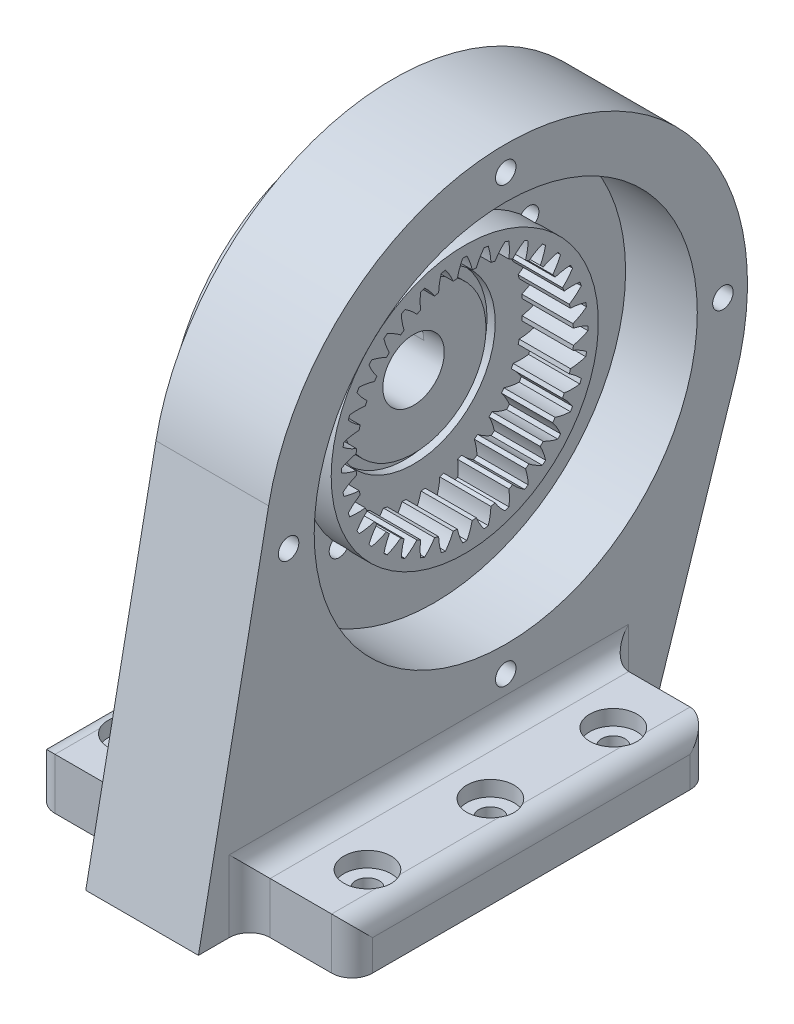
from build123d import *

# Parameters (mm, degrees)
BASPROSKE_W                                         = 12.7
BASPROSKE_H                                         = 3.598545
TOOTHCUT_DEPTH                                      = 46.081063624
TEETHCUTS_COUNT                                     = 36
EXTRUDE_THIN1_START                                 = 12.7
SKETCH3_R                                           = 33.126045
SKETCH3_R_2                                         = 30.586045
EXTRUDE_THIN1_DEPTH                                 = 12.7
EXTRUDE_THIN2_START                                 = 5.08
SKETCH4_R                                           = 39.476045
SKETCH4_R_2                                         = 33.126045
EXTRUDE_THIN2_DEPTH                                 = 5.08
BOSS_EXTRUDE2_START                                 = -5.08
SKETCH9_R                                           = 59.944
SKETCH9_R_2                                         = 39.476045
BOSS_EXTRUDE2_DEPTH                                 = 5.08
SKETCH12_R                                          = 59.944
BOSS_EXTRUDE3_DEPTH                                 = 5.08
SKETCH13_R                                          = 20.2565
SKETCH13_R_2                                        = 17.9705
CUT_EXTRUDE10_DEPTH                                 = 2.032
CUT_EXTRUDE11_DEPTH                                 = 87.618096677
CUT_EXTRUDE11_DEPTH_BACK                            = 87.618096677
SKETCH14_R                                          = 3.302
BOSS_EXTRUDE5_START                                 = 17.78
SKETCH15_R                                          = 59.944
SKETCH15_R_2                                        = 47.498
BOSS_EXTRUDE5_DEPTH                                 = 17.78
CBORE_FOR_00_BINDING_HEAD_MACHINE_SCREW_D           = 5.08
CBORE_FOR_00_BINDING_HEAD_MACHINE_SCREW_CBORE_D     = 7.62
CBORE_FOR_00_BINDING_HEAD_MACHINE_SCREW_CBORE_DEPTH = 1.27
SKETCH21_R                                          = 19.05
CUT_EXTRUDE12_DEPTH                                 = 1.524
SKETCH22_R                                          = 2.5
CUT_EXTRUDE13_DEPTH                                 = 90.259228498
SKETCH23_R                                          = 2.794
CUT_EXTRUDE14_DEPTH                                 = 7.62
BOSS_EXTRUDE6_DEPTH                                 = 3.81
SKETCH26_R                                          = 7.62
CUT_EXTRUDE15_DEPTH                                 = 89.793982499
BOSS_EXTRUDE8_START                                 = 1.524
SKETCH28_R                                          = 19.05
SKETCH28_R_2                                        = 7.62
BOSS_EXTRUDE8_DEPTH                                 = 1.524
SKETCH29_R                                          = 44.45
BOSS_EXTRUDE9_DEPTH                                 = 11.62
SKETCH30_R                                          = 7.62
SKETCH30_R_2                                        = 2.5
CUT_EXTRUDE16_DEPTH                                 = 90.259228498
SKETCH31_W                                          = 15.24
SKETCH31_H                                          = 50.8
CUT_EXTRUDE17_DEPTH                                 = 11.62
SKETCH32_R                                          = 19.05
CUT_EXTRUDE18_DEPTH                                 = 1.6
SKETCH33_R                                          = 3.048
CUT_EXTRUDE19_DEPTH                                 = 3.81
CIRPATTERN1_COUNT                                   = 4
BOSS_EXTRUDE10_DEPTH                                = 27.94
BOSS_EXTRUDE12_DEPTH                                = 25.4
BOSS_EXTRUDE12_DEPTH_BACK                           = 53.34
SKETCH45_W                                          = 88.9
SKETCH45_H                                          = 12.7
FILLET2_R                                           = 5.08
FILLET3_R                                           = 5.08
CBORE_FOR_M5_HEX_HEAD_MACHINE_SCREW1_D              = 5.8
CBORE_FOR_M5_HEX_HEAD_MACHINE_SCREW1_DEPTH          = 12.7
CBORE_FOR_M5_HEX_HEAD_MACHINE_SCREW1_CBORE_D        = 11.71
CBORE_FOR_M5_HEX_HEAD_MACHINE_SCREW1_CBORE_DEPTH    = 3.8


with BuildPart() as part:
    # BasProSke → Base-Revolve (revolve)
    with BuildSketch(Plane(origin=(0, 0, 0), x_dir=(1, 0, 0), z_dir=(0, 1, 0)), mode=Mode.PRIVATE) as base_revolve_sk:
        with Locations((6.35, 28.7867725)):
            Rectangle(BASPROSKE_W, BASPROSKE_H)
    revolve(base_revolve_sk.sketch.rotate(Axis((-10, 0, 0), (1, 0, 0)), 180), axis=Axis((-10, 0, 0), (1, 0, 0)))

    # TooCutSke → ToothCut (cut, through all)
    with BuildSketch(Plane(origin=(0, 0, 0), x_dir=(0, 0, -1), z_dir=(1, 0, 0))):
        with BuildLine():
            ThreePointArc((1.841725032, 26.899124248), (1.308199168, 28.772624617), (0.524789557, 30.556138806))
            ThreePointArc((0.524789557, 30.556138806), (0, 30.560645), (-0.524789557, 30.556138806))
            ThreePointArc((-0.524789557, 30.556138806), (-1.308199168, 28.772624617), (-1.841725032, 26.899124248))
            ThreePointArc((-1.841725032, 26.899124248), (0, 26.9621), (1.841725032, 26.899124248))
        make_face()
    toothcut = extrude(amount=TOOTHCUT_DEPTH, mode=Mode.SUBTRACT)

    # TeethCuts: ToothCut ×36 about axis
    teethcuts_axis = Axis((0, 0, 0), (1, 0, 0))
    for i in range(1, TEETHCUTS_COUNT):
        add(toothcut.rotate(teethcuts_axis, i * 360 / TEETHCUTS_COUNT), mode=Mode.SUBTRACT)

    # Sketch3 → Extrude-Thin1 (add)
    with BuildSketch(Plane(origin=(0, 0, 0), x_dir=(0, 0, -1), z_dir=(1, 0, 0)).offset(EXTRUDE_THIN1_START)):
        Circle(SKETCH3_R)
        Circle(SKETCH3_R_2, mode=Mode.SUBTRACT)
    extrude(amount=-EXTRUDE_THIN1_DEPTH)

    # Sketch4 → Extrude-Thin2 (add)
    with BuildSketch(Plane(origin=(0, 0, 0), x_dir=(0, 0, -1), z_dir=(1, 0, 0)).offset(EXTRUDE_THIN2_START)):
        Circle(SKETCH4_R)
        Circle(SKETCH4_R_2, mode=Mode.SUBTRACT)
    extrude(amount=-EXTRUDE_THIN2_DEPTH)

    # Sketch9 → Boss-Extrude2 (add)
    with BuildSketch(Plane.ZY.offset(BOSS_EXTRUDE2_START)):
        Circle(SKETCH9_R)
        Circle(SKETCH9_R_2, mode=Mode.SUBTRACT)
    extrude(amount=BOSS_EXTRUDE2_DEPTH)

    # Sketch12 → Boss-Extrude3 (add)
    with BuildSketch(Plane.ZY):
        Circle(SKETCH12_R)
    extrude(amount=BOSS_EXTRUDE3_DEPTH)

    # Sketch13 → Cut-Extrude10 (cut)
    with BuildSketch(Plane(origin=(0, 0, 0), x_dir=(0, 0, -1), z_dir=(1, 0, 0))):
        Circle(SKETCH13_R)
        Circle(SKETCH13_R_2, mode=Mode.SUBTRACT)
    extrude(amount=-CUT_EXTRUDE10_DEPTH, mode=Mode.SUBTRACT)

    # Sketch14 → Cut-Extrude11 (cut, two sides: drawn at the far end of the back side and taken through both)
    with BuildSketch(Plane.ZY.offset(5.08).offset(-CUT_EXTRUDE11_DEPTH_BACK)):
        Circle(SKETCH14_R)
    extrude(amount=CUT_EXTRUDE11_DEPTH + CUT_EXTRUDE11_DEPTH_BACK, mode=Mode.SUBTRACT)

    # Sketch15 → Boss-Extrude5 (add)
    with BuildSketch(Plane(origin=(5.08, 0, 0), x_dir=(0, 0, -1), z_dir=(1, 0, 0)).offset(BOSS_EXTRUDE5_START)):
        with Locations(Location((0, 0, 0), (0, 0, 180))):
            Circle(SKETCH15_R)
        Circle(SKETCH15_R_2, mode=Mode.SUBTRACT)
    extrude(amount=-BOSS_EXTRUDE5_DEPTH)

    # CBORE for #00 Binding Head Machine Screw1 (through all)
    with Locations(Plane.ZY.offset(5.08)):
        with Locations((0, 53.848), (53.848, 0), (0, -53.848), (-53.848, 0)):
            CounterBoreHole(CBORE_FOR_00_BINDING_HEAD_MACHINE_SCREW_D / 2, CBORE_FOR_00_BINDING_HEAD_MACHINE_SCREW_CBORE_D / 2, CBORE_FOR_00_BINDING_HEAD_MACHINE_SCREW_CBORE_DEPTH)

    # Sketch21 → Cut-Extrude12 (cut)
    with BuildSketch(Plane.ZY.offset(5.08)):
        Circle(SKETCH21_R)
    extrude(amount=-CUT_EXTRUDE12_DEPTH, mode=Mode.SUBTRACT)

    # Sketch22 → Cut-Extrude13 (cut, through all)
    with BuildSketch(Plane.ZY.offset(5.08)):
        with Locations((23.5, -23.5)):
            Circle(SKETCH22_R)
        with Locations((-23.5, -23.5)):
            Circle(SKETCH22_R)
        with Locations((-23.5, 23.5)):
            Circle(SKETCH22_R)
        with Locations((23.5, 23.5)):
            Circle(SKETCH22_R)
    extrude(amount=-CUT_EXTRUDE13_DEPTH, mode=Mode.SUBTRACT)

    # Sketch23 → Cut-Extrude14 (cut)
    with BuildSketch(Plane(origin=(12.7, 0, 0), x_dir=(0, 0, -1), z_dir=(1, 0, 0))):
        with Locations((23.5, 23.5)):
            Circle(SKETCH23_R)
        with Locations((-23.5, 23.5)):
            Circle(SKETCH23_R)
        with Locations((-23.5, -23.5)):
            Circle(SKETCH23_R)
        with Locations((23.5, -23.5)):
            Circle(SKETCH23_R)
    extrude(amount=-CUT_EXTRUDE14_DEPTH, mode=Mode.SUBTRACT)

    # Sketch24 → Boss-Extrude6 (add)
    with BuildSketch(Plane(origin=(12.7, 0, 0), x_dir=(0, 0, -1), z_dir=(1, 0, 0))):
        with BuildLine():
            ThreePointArc((25.309953723, 21.37150205), (23.423651053, 23.423651053), (21.37150205, 25.309953723))
            ThreePointArc((21.37150205, 25.309953723), (21.524343653, 21.524343653), (25.309953723, 21.37150205))
        make_face()
        with BuildLine():
            ThreePointArc((25.309953723, -21.37150205), (21.524343653, -21.524343653), (21.37150205, -25.309953723))
            ThreePointArc((21.37150205, -25.309953723), (23.423651053, -23.423651053), (25.309953723, -21.37150205))
        make_face()
        with BuildLine():
            ThreePointArc((-21.37150205, -25.309953723), (-21.524343653, -21.524343653), (-25.309953723, -21.37150205))
            ThreePointArc((-25.309953723, -21.37150205), (-23.423651053, -23.423651053), (-21.37150205, -25.309953723))
        make_face()
        with BuildLine():
            ThreePointArc((-25.309953723, 21.37150205), (-21.524343653, 21.524343653), (-21.37150205, 25.309953723))
            ThreePointArc((-21.37150205, 25.309953723), (-23.423651053, 23.423651053), (-25.309953723, 21.37150205))
        make_face()
    extrude(amount=-BOSS_EXTRUDE6_DEPTH)

    # Sketch26 → Cut-Extrude15 (cut, through all)
    with BuildSketch(Plane.ZY.offset(3.556)):
        Circle(SKETCH26_R)
    extrude(amount=-CUT_EXTRUDE15_DEPTH, mode=Mode.SUBTRACT)

    # Sketch28 → Boss-Extrude8 (add)
    with BuildSketch(Plane.ZY.offset(3.556).offset(BOSS_EXTRUDE8_START)):
        Circle(SKETCH28_R)
        Circle(SKETCH28_R_2, mode=Mode.SUBTRACT)
    extrude(amount=-BOSS_EXTRUDE8_DEPTH)

    # Sketch29 → Boss-Extrude9 (add)
    with BuildSketch(Plane.ZY.offset(5.08)):
        Circle(SKETCH29_R)
    extrude(amount=BOSS_EXTRUDE9_DEPTH)

    # Sketch30 → Cut-Extrude16 (cut, through all)
    with BuildSketch(Plane(origin=(-5.08, 0, 0), x_dir=(0, 0, -1), z_dir=(1, 0, 0))):
        with Locations(Location((0, 0, 0), (0, 0, 180))):
            Circle(SKETCH30_R)
        with Locations((23.5, -23.5)):
            Circle(SKETCH30_R_2)
        with Locations((23.5, 23.5)):
            Circle(SKETCH30_R_2)
        with Locations((-23.5, 23.5)):
            Circle(SKETCH30_R_2)
        with Locations((-23.5, -23.5)):
            Circle(SKETCH30_R_2)
    extrude(amount=-CUT_EXTRUDE16_DEPTH, mode=Mode.SUBTRACT)

    # Sketch31 → Cut-Extrude17 (cut)
    with BuildSketch(Plane.ZY.offset(16.7)):
        with Locations((0, 25.4)):
            Rectangle(SKETCH31_W, SKETCH31_H)
    extrude(amount=-CUT_EXTRUDE17_DEPTH, mode=Mode.SUBTRACT)

    # Sketch32 → Cut-Extrude18 (cut)
    with BuildSketch(Plane.ZY.offset(16.7)):
        Circle(SKETCH32_R)
    extrude(amount=-CUT_EXTRUDE18_DEPTH, mode=Mode.SUBTRACT)

    # Sketch33 → Cut-Extrude19 (cut)
    with BuildSketch(Plane(origin=(5.08, 0, 0), x_dir=(0, 0, -1), z_dir=(1, 0, 0))):
        with Locations((-23.5, 23.5)):
            Circle(SKETCH33_R)
    cut_extrude19 = extrude(amount=CUT_EXTRUDE19_DEPTH, mode=Mode.SUBTRACT)

    # CirPattern1: Cut-Extrude19 ×4 about axis
    cirpattern1_axis = Axis((0, 0, 0), (1, 0, 0))
    for i in range(1, CIRPATTERN1_COUNT):
        add(cut_extrude19.rotate(cirpattern1_axis, i * 360 / CIRPATTERN1_COUNT), mode=Mode.SUBTRACT)

    # Sketch34 → Boss-Extrude10 (add)
    with BuildSketch(Plane(origin=(22.86, 0, 0), x_dir=(0, 0, -1), z_dir=(1, 0, 0))):
        with BuildLine():
            Line((-58.801839412, 11.645892745), (-76.2, -76.2))
            Line((-76.2, -76.2), (38.1, -76.2))
            Line((38.1, -76.2), (56.96053076, -18.675681287))
            ThreePointArc((56.96053076, -18.675681287), (-15.188715131, -57.987809656), (-58.801839412, 11.645892745))
        make_face()
    extrude(amount=-BOSS_EXTRUDE10_DEPTH)

    # Sketch45 → Boss-Extrude12 (add, two sides: drawn at the far end of the back side and taken through both)
    with BuildSketch(Plane(origin=(22.86, 0, 0), x_dir=(0, 0, -1), z_dir=(1, 0, 0)).offset(-BOSS_EXTRUDE12_DEPTH_BACK)):
        with Locations((-19.05, -69.85)):
            Rectangle(SKETCH45_W, SKETCH45_H)
    extrude(amount=BOSS_EXTRUDE12_DEPTH + BOSS_EXTRUDE12_DEPTH_BACK)

    # Fillet2
    fillet2_edges = [part.edges().sort_by_distance(p)[0] for p in [
        (22.86, -63.5, 19.05),
        (-5.08, -63.5, 19.05),
        (-5.08, -69.85, -25.4),
        (-5.08, -69.85, 63.5),
        (22.86, -69.85, -25.4),
        (22.86, -69.85, 63.5),
    ]]
    fillet(fillet2_edges, radius=FILLET2_R)

    # Fillet3
    fillet3_edges = [part.edges().sort_by_distance(p)[0] for p in [
        (-30.48, -63.5, 19.05),
        (-30.48, -69.85, -25.4),
        (-30.48, -69.85, 63.5),
        (48.26, -69.85, 63.5),
        (48.26, -69.85, -25.4),
        (48.26, -63.5, 19.05),
    ]]
    fillet(fillet3_edges, radius=FILLET3_R)

    # CBORE for M5 Hex Head Machine Screw1
    with Locations(Plane(origin=(0, -63.5, 0), x_dir=(1, 0, 0), z_dir=(0, 1, 0))):
        with Locations((38.1, -19.05), (-20.32, -19.05), (-20.32, 11.43), (-20.32, -49.53), (38.1, 11.43), (38.1, -49.53)):
            CounterBoreHole(CBORE_FOR_M5_HEX_HEAD_MACHINE_SCREW1_D / 2, CBORE_FOR_M5_HEX_HEAD_MACHINE_SCREW1_CBORE_D / 2, CBORE_FOR_M5_HEX_HEAD_MACHINE_SCREW1_CBORE_DEPTH, depth=CBORE_FOR_M5_HEX_HEAD_MACHINE_SCREW1_DEPTH)


solid = part.part
